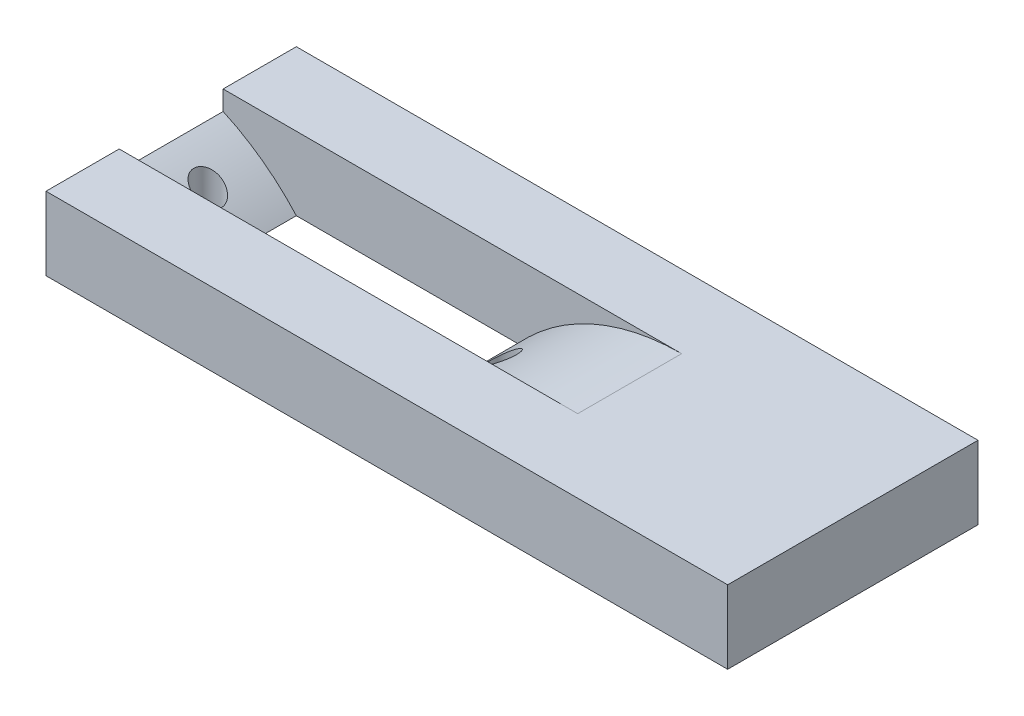
from build123d import *

# Parameters (mm, degrees)
SKETCH_1_W                = 50.28
SKETCH_1_H                = 34.2
SKETCH_1_W_2              = 30.28
SKETCH_1_H_2              = 14.2
EXTRUDE_1_DEPTH           = 12.25
SKETCH_4_W                = 13
SKETCH_4_H                = 13.91
EXTRUDE_1_2_DEPTH         = 74.82
SKETCH_5_W                = 13.91
SKETCH_5_H                = 16.23
EXTRUDE_2_DEPTH           = 16
SKETCH_7_R                = 25.25
SKETCH_7_R_2              = 15.25
EXTRUDE_2_2_DEPTH         = 16.23
SKETCH_15_R               = 1.91
CUT_EXTRUDE_6_DEPTH       = 97.964478439
SKETCH_18_W               = 49.344544624
SKETCH_18_H               = 6.125
CUT_EXTRUDE_8_DEPTH       = 101.789238284
SKETCH_19_W               = 34.2
SKETCH_19_H               = 6.125
CUT_EXTRUDE_9_DEPTH       = 10
SKETCH_21_R               = 1.91
CUT_EXTRUDE_10_DEPTH      = 10
SKETCH_20_R               = 1.91
CUT_EXTRUDE_11_DEPTH      = 10
FILLET_START              = -7.1
FILLET_1_DEPTH            = 14.2
FILLET_2_DEPTH            = 14.2
SKETCH_29_W               = 13.91
SKETCH_29_H               = 74.82
EXTRUDE_5_DEPTH           = 10
SKETCH_30_W               = 10
SKETCH_30_H               = 58.59
CUT_EXTRUDE_13_DEPTH      = 97.964478439
SKETCH_32_W               = 34.2
SKETCH_32_H               = 5.745736365
EXTRUDE_6_DEPTH           = 10
CUT_EXTRUDE_16_DEPTH      = 50
CUT_EXTRUDE_16_DEPTH_BACK = 50
SKETCH_38_W               = 116.985630298
SKETCH_38_H               = 80.538350638
SKETCH_41_W               = 13.91
SKETCH_41_H               = 5.745736365
EXTRUDE_7_DEPTH           = 3
SKETCH_42_W               = 13
SKETCH_42_H               = 13.91
EXTRUDE_8_DEPTH           = 74.82
SKETCH_43_W               = 13.91
SKETCH_43_H               = 16.23
EXTRUDE_9_DEPTH           = 15.22
SKETCH_44_R               = 1.91
CUT_EXTRUDE_17_DEPTH      = 15.22
SKETCH_46_R               = 25.25
SKETCH_46_R_2             = 15.25
EXTRUDE_6_2_DEPTH         = 16.23
EXTRUDE_10_DEPTH          = 7.22
EXTRUDE_10_DEPTH_BACK     = 10
SKETCH_47_W               = 13.91
SKETCH_47_H               = 16.23
SKETCH_50_W               = 3.056753925
SKETCH_50_H               = 16.23
CUT_EXTRUDE_18_DEPTH      = 96.578211037
SKETCH_51_R               = 1.91
CUT_EXTRUDE_19_DEPTH      = 95.015226304
SKETCH_52_W               = 92.841945613
SKETCH_52_H               = 30
CUT_EXTRUDE_20_DEPTH      = 84.840694713
CUT_EXTRUDE_22_DEPTH      = 50
CUT_EXTRUDE_22_DEPTH_BACK = 50
SKETCH_53_W               = 63.541345486
SKETCH_53_H               = 14.170740414
SKETCH_54_W               = 10
SKETCH_54_H               = 10.145
CUT_EXTRUDE_23_DEPTH      = 50
SKETCH_55_W               = 13
SKETCH_55_H               = 13.91
EXTRUDE_11_DEPTH          = 10
SKETCH_57_W               = 15
SKETCH_57_H               = 34.2
EXTRUDE_12_DEPTH          = 10
SKETCH_58_W               = 34.2
SKETCH_58_H               = 10
EXTRUDE_13_DEPTH          = 27.85
SKETCH_60_W               = 34.2
SKETCH_60_H               = 10
EXTRUDE_14_DEPTH          = 50.28
SKETCH_62_W               = 30.28
SKETCH_62_H               = 14.2
CUT_EXTRUDE_24_DEPTH      = 50.28
SKETCH_64_R               = 1.91
CUT_EXTRUDE_25_DEPTH      = 10
FILLET_3_R                = 30
CUT_EXTRUDE_27_DEPTH      = 40
CUT_EXTRUDE_27_DEPTH_BACK = 40
SKETCH_69_W               = 103.83153819
SKETCH_69_H               = 99.848427979


with BuildPart() as part:
    # 草圖1 → Extrude 1 (new body)
    with BuildSketch(Plane(origin=(0, 0, 0), x_dir=(1, 0, 0), z_dir=(0, 1, 0))):
        Rectangle(SKETCH_1_W, SKETCH_1_H)
        Rectangle(SKETCH_1_W_2, SKETCH_1_H_2, mode=Mode.SUBTRACT)
    extrude(amount=EXTRUDE_1_DEPTH)

    # 草圖4 → Extrude 1 2 (add)
    with BuildSketch(Plane.XZ):
        with Locations((18.64, 0)):
            Rectangle(SKETCH_4_W, SKETCH_4_H)
    extrude(amount=EXTRUDE_1_2_DEPTH)

    # 草圖5 → Extrude 2 (add)
    with BuildSketch(Plane.ZY.offset(-12.14)):
        with Locations((0, -66.705)):
            Rectangle(SKETCH_5_W, SKETCH_5_H)
    extrude(amount=EXTRUDE_2_DEPTH)

    # 草圖7 → Extrude 2 2 (add)
    with BuildSketch(Plane(origin=(3.626674765, -74.82, 0), x_dir=(1, 0, 0), z_dir=(0, -1, 0))):
        with Locations((-30.978154344, 0)):
            Circle(SKETCH_7_R)
        with Locations((-30.978154344, 0)):
            Circle(SKETCH_7_R_2, mode=Mode.SUBTRACT)
    extrude(amount=-EXTRUDE_2_2_DEPTH)

    # 草圖15 → 除料-伸長6 (cut, through all)
    with BuildSketch(Plane(origin=(0, 0, -6.955), x_dir=(-1, 0, 0), z_dir=(0, 0, -1))):
        with Locations((-4.530883248, -66.705)):
            Circle(SKETCH_15_R)
    extrude(amount=-CUT_EXTRUDE_6_DEPTH, mode=Mode.SUBTRACT)

    # 草圖18 → 除料-伸長8 (cut, through all)
    with BuildSketch(Plane(origin=(0, 0, -17.1), x_dir=(-1, 0, 0), z_dir=(0, 0, -1))):
        with Locations((0.467727688, 9.1875)):
            Rectangle(SKETCH_18_W, SKETCH_18_H)
    extrude(amount=-CUT_EXTRUDE_8_DEPTH, mode=Mode.SUBTRACT)

    # 草圖19 → 除料-伸長9 (cut)
    with BuildSketch(Plane.ZY.offset(-24.204544624)):
        with Locations((0, 9.1875)):
            Rectangle(SKETCH_19_W, SKETCH_19_H)
    extrude(amount=-CUT_EXTRUDE_9_DEPTH, mode=Mode.SUBTRACT)

    # 草圖21 → 除料-伸長10 (cut)
    with BuildSketch(Plane(origin=(0, 6.125, 0), x_dir=(1, 0, 0), z_dir=(0, 1, 0))):
        with Locations(Location((17.69, 0, 0), (0, 0, 270))):
            Circle(SKETCH_21_R)
    extrude(amount=-CUT_EXTRUDE_10_DEPTH, mode=Mode.SUBTRACT)

    # 草圖20 → 除料-伸長11 (cut)
    with BuildSketch(Plane(origin=(0, 6.125, 0), x_dir=(1, 0, 0), z_dir=(0, 1, 0))):
        with Locations(Location((-17.395, 0, 0), (0, 0, 270))):
            Circle(SKETCH_20_R)
    extrude(amount=-CUT_EXTRUDE_11_DEPTH, mode=Mode.SUBTRACT)

    # 圓角1: read off the stored shape, not the designer's step
    # 圓角1 outline → 圓角1 (cut)
    with BuildSketch(Plane.XY.offset(FILLET_START)):
        with BuildLine():
            add(Edge.make_bspline(
                [(-15.14, 0), (-21.974170252, 5.199829476), (-25.14, 5.745736365)],
                knots=[0, 0, 0, 0.664102345, 0.664102345, 0.664102345], degree=2, weights=[1, 2.223777218, 1.822127795]))
            Line((-15.14, 0), (-15.14, 6.125))
            Line((-15.14, 6.125), (-25.14, 6.125))
            Line((-25.14, 6.125), (-25.14, 5.745736365))
        make_face()
    extrude(amount=FILLET_1_DEPTH, mode=Mode.SUBTRACT)

    # 圓角2: read off the stored shape, not the designer's step
    # 圓角2 outline → 圓角2 (cut)
    with BuildSketch(Plane.XY.offset(FILLET_START)):
        with BuildLine():
            Line((15.14, 6.125), (15.14, 0))
            add(Edge.make_bspline(
                [(15.14, 0), (21.974170252, 5.199829476), (25.14, 5.745736365)],
                knots=[0, 0, 0, 0.664102345, 0.664102345, 0.664102345], degree=2, weights=[1, 2.223777218, 1.822127795]))
            Line((25.14, 5.745736365), (25.14, 6.125))
            Line((25.14, 6.125), (15.14, 6.125))
        make_face()
    extrude(amount=FILLET_2_DEPTH, mode=Mode.SUBTRACT)

    # 草圖29 → 填料-伸長5 (add)
    with BuildSketch(Plane(origin=(25.14, 0, 0), x_dir=(0, 0, -1), z_dir=(1, 0, 0))):
        with Locations((0, -37.41)):
            Rectangle(SKETCH_29_W, SKETCH_29_H)
    extrude(amount=EXTRUDE_5_DEPTH)

    # 草圖30 → 除料-伸長13 (cut, through all)
    with BuildSketch(Plane.XY.offset(6.955)):
        with Locations((17.14, -29.295)):
            Rectangle(SKETCH_30_W, SKETCH_30_H)
    extrude(amount=-CUT_EXTRUDE_13_DEPTH, mode=Mode.SUBTRACT)

    # 草圖32 → Extrude 6 (add)
    with BuildSketch(Plane(origin=(25.14, 0, 0), x_dir=(0, 0, -1), z_dir=(1, 0, 0))):
        with Locations((0, 2.872868182)):
            Rectangle(SKETCH_32_W, SKETCH_32_H)
    extrude(amount=EXTRUDE_6_DEPTH)

    # 草圖38 → 除料-伸長16 (cut, two sides: drawn at the far end of the back side and taken through both)
    with BuildSketch(Plane(origin=(0, 0, -6.955), x_dir=(-1, 0, 0), z_dir=(0, 0, -1)).offset(-CUT_EXTRUDE_16_DEPTH_BACK)):
        with Locations((7.268869252, -40.269175319)):
            Rectangle(SKETCH_38_W, SKETCH_38_H)
    extrude(amount=CUT_EXTRUDE_16_DEPTH + CUT_EXTRUDE_16_DEPTH_BACK, mode=Mode.SUBTRACT)

    # 草圖41 → 填料-伸長7 (add)
    with BuildSketch(Plane(origin=(35.14, 0, 0), x_dir=(0, 0, -1), z_dir=(1, 0, 0))):
        with Locations((0, 2.872868182)):
            Rectangle(SKETCH_41_W, SKETCH_41_H)
    extrude(amount=EXTRUDE_7_DEPTH)

    # 草圖42 → 填料-伸長8 (add)
    with BuildSketch(Plane(origin=(0, 0, 0), x_dir=(-1, 0, 0), z_dir=(0, -1, 0))):
        with Locations((-31.64, 0)):
            Rectangle(SKETCH_42_W, SKETCH_42_H)
    extrude(amount=EXTRUDE_8_DEPTH)

    # 草圖43 → 填料-伸長9 (add)
    with BuildSketch(Plane.ZY.offset(-25.14)):
        with Locations((0, -66.705)):
            Rectangle(SKETCH_43_W, SKETCH_43_H)
    extrude(amount=EXTRUDE_9_DEPTH)

    # 草圖44 → 除料-伸長17 (cut)
    with BuildSketch(Plane(origin=(0, 0, -6.955), x_dir=(-1, 0, 0), z_dir=(0, 0, -1))):
        with Locations(Location((-17.524895264, -66.705, 0), (0, 0, 90))):
            Circle(SKETCH_44_R)
    extrude(amount=-CUT_EXTRUDE_17_DEPTH, mode=Mode.SUBTRACT)

    # 草圖46 → Extrude 6 2 (add)
    with BuildSketch(Plane(origin=(0, -58.59, 0), x_dir=(1, 0, 0), z_dir=(0, 1, 0))):
        with Locations((-14.35, 0)):
            Circle(SKETCH_46_R)
        with Locations((-14.35, 0)):
            Circle(SKETCH_46_R_2, mode=Mode.SUBTRACT)
    extrude(amount=-EXTRUDE_6_2_DEPTH)

    # 草圖47 → 填料-伸長10 (add, two sides: drawn at the far end of the back side and taken through both)
    with BuildSketch(Plane(origin=(-40, 0, 0), x_dir=(0, 0, -1), z_dir=(1, 0, 0)).offset(-EXTRUDE_10_DEPTH_BACK)):
        with Locations((0, -66.705)):
            Rectangle(SKETCH_47_W, SKETCH_47_H)
    extrude(amount=EXTRUDE_10_DEPTH + EXTRUDE_10_DEPTH_BACK)

    # 草圖50 → 除料-伸長18 (cut, through all)
    with BuildSketch(Plane(origin=(0, 0, -6.955), x_dir=(-1, 0, 0), z_dir=(0, 0, -1))):
        with Locations((48.471623038, -66.705)):
            Rectangle(SKETCH_50_W, SKETCH_50_H)
    extrude(amount=-CUT_EXTRUDE_18_DEPTH, mode=Mode.SUBTRACT)

    # 草圖51 → 除料-伸長19 (cut, through all)
    with BuildSketch(Plane(origin=(0, 0, -6.955), x_dir=(-1, 0, 0), z_dir=(0, 0, -1))):
        with Locations((42.786508152, -66.705)):
            Circle(SKETCH_51_R)
    extrude(amount=-CUT_EXTRUDE_19_DEPTH, mode=Mode.SUBTRACT)

    # 草圖52 → 除料-伸長20 (cut, through all)
    with BuildSketch(Plane(origin=(0, -58.59, 0), x_dir=(1, 0, 0), z_dir=(0, 1, 0))):
        with Locations((-21.280972807, 15)):
            Rectangle(SKETCH_52_W, SKETCH_52_H)
    extrude(amount=-CUT_EXTRUDE_20_DEPTH, mode=Mode.SUBTRACT)

    # 草圖53 → 除料-伸長22 (cut, two sides: drawn at the far end of the back side and taken through both)
    with BuildSketch(Plane(origin=(0, 0, -6.955), x_dir=(-1, 0, 0), z_dir=(0, 0, -1)).offset(-CUT_EXTRUDE_22_DEPTH_BACK)):
        with Locations((6.630672743, -0.960370207)):
            Rectangle(SKETCH_53_W, SKETCH_53_H)
    extrude(amount=CUT_EXTRUDE_22_DEPTH + CUT_EXTRUDE_22_DEPTH_BACK, mode=Mode.SUBTRACT)

    # 草圖54 → 除料-伸長23 (cut)
    with BuildSketch(Plane(origin=(0, 5.745736365, 0), x_dir=(1, 0, 0), z_dir=(0, 1, 0))):
        with Locations((30.14, -12.0275)):
            Rectangle(SKETCH_54_W, SKETCH_54_H)
        with Locations((30.14, 12.0275)):
            Rectangle(SKETCH_54_W, SKETCH_54_H)
    extrude(amount=-CUT_EXTRUDE_23_DEPTH, mode=Mode.SUBTRACT)

    # 草圖55 → 填料-伸長11 (add)
    with BuildSketch(Plane(origin=(0, 5.745736365, 0), x_dir=(1, 0, 0), z_dir=(0, 1, 0))):
        with Locations((31.64, 0)):
            Rectangle(SKETCH_55_W, SKETCH_55_H)
    extrude(amount=EXTRUDE_11_DEPTH)

    # 草圖57 → 填料-伸長12 (add)
    with BuildSketch(Plane(origin=(0, 15.745736365, 0), x_dir=(1, 0, 0), z_dir=(0, 1, 0))):
        with Locations((31.64, 0)):
            Rectangle(SKETCH_57_W, SKETCH_57_H)
    extrude(amount=EXTRUDE_12_DEPTH)

    # 草圖58 → 填料-伸長13 (add)
    with BuildSketch(Plane.ZY.offset(-24.14)):
        with Locations((0, 20.745736365)):
            Rectangle(SKETCH_58_W, SKETCH_58_H)
    extrude(amount=EXTRUDE_13_DEPTH)

    # 草圖60 → 填料-伸長14 (add)
    with BuildSketch(Plane.ZY.offset(3.71)):
        with Locations((0, 20.745736365)):
            Rectangle(SKETCH_60_W, SKETCH_60_H)
    extrude(amount=EXTRUDE_14_DEPTH)

    # 草圖62 → 除料-伸長24 (cut)
    with BuildSketch(Plane(origin=(0, 25.745736365, 0), x_dir=(1, 0, 0), z_dir=(0, 1, 0))):
        with Locations((-28.85, 0)):
            Rectangle(SKETCH_62_W, SKETCH_62_H)
    extrude(amount=-CUT_EXTRUDE_24_DEPTH, mode=Mode.SUBTRACT)

    # 草圖64 → 除料-伸長25 (cut)
    with BuildSketch(Plane(origin=(0, 25.745736365, 0), x_dir=(1, 0, 0), z_dir=(0, 1, 0))):
        with Locations(Location((-8.71, 0, 0), (0, 0, 270))):
            Circle(SKETCH_64_R)
        with Locations(Location((-48.99, 0, 0), (0, 0, 270))):
            Circle(SKETCH_64_R)
    extrude(amount=-CUT_EXTRUDE_25_DEPTH, mode=Mode.SUBTRACT)

    # 圓角3
    # the kernel refuses this fillet: 30 mm, written as the material it takes off along each edge
    with BuildSketch(Plane(origin=(-43.99, 25.745736365, 7.1), x_dir=(-1, 0, 0), z_dir=(0, 0, -1)), Plane(origin=(-13.71, 25.745736365, -7.1), x_dir=(1, 0, 0), z_dir=(0, 0, 1))) as fillet_3_piece_1:
        with BuildLine():
            CenterArc((22.360679775, -30), FILLET_3_R, 90, 48.189685104)
            Line((0, -10), (0, 0))
            Line((0, 0), (22.360679775, 0))
        make_face()
    extrude(amount=14.2, mode=Mode.SUBTRACT)

    # 草圖69 → 除料-伸長27 (cut, two sides: drawn at the far end of the back side and taken through both)
    with BuildSketch(Plane(origin=(0, 0, 0), x_dir=(-1, 0, 0), z_dir=(0, 0, -1)).offset(-CUT_EXTRUDE_27_DEPTH_BACK)):
        with Locations((12.775769095, -34.178477625)):
            Rectangle(SKETCH_69_W, SKETCH_69_H)
    extrude(amount=CUT_EXTRUDE_27_DEPTH + CUT_EXTRUDE_27_DEPTH_BACK, mode=Mode.SUBTRACT)


solid = part.part
